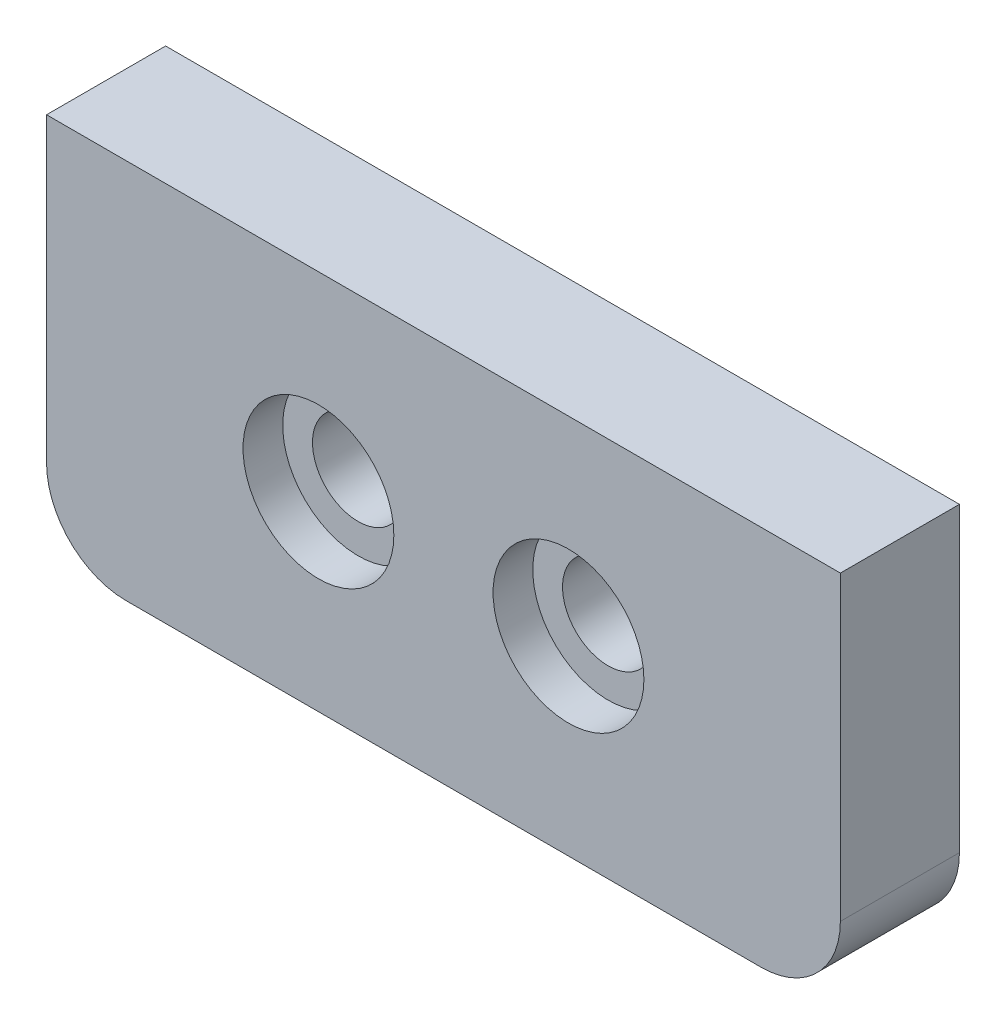
from build123d import *

# Parameters (mm, degrees)
SKETCH1_W           = 20
SKETCH1_H           = 9.6
SKETCH1_R           = 1.15
BOSS_EXTRUDE1_DEPTH = 3
FILLET1_R           = 2
SKETCH2_R           = 1.9
CUT_EXTRUDE1_DEPTH  = 1


with BuildPart() as part:
    # Sketch1 → Boss-Extrude1 (new body)
    with BuildSketch(Plane.XY):
        with Locations((10, 4.8)):
            Rectangle(SKETCH1_W, SKETCH1_H)
        with Locations((6.85, 4.8)):
            Circle(SKETCH1_R, mode=Mode.SUBTRACT)
        with Locations((13.15, 4.8)):
            Circle(SKETCH1_R, mode=Mode.SUBTRACT)
    extrude(amount=BOSS_EXTRUDE1_DEPTH)

    # Fillet1
    fillet1_edges = [part.edges().sort_by_distance(p)[0] for p in [
        (0, 0, 1.5),
        (20, 0, 1.5),
    ]]
    fillet(fillet1_edges, radius=FILLET1_R)

    # Sketch2 → Cut-Extrude1 (cut)
    with BuildSketch(Plane.XY.offset(3)):
        with Locations((6.85, 4.8)):
            Circle(SKETCH2_R)
        with Locations((13.15, 4.8)):
            Circle(SKETCH2_R)
    extrude(amount=-CUT_EXTRUDE1_DEPTH, mode=Mode.SUBTRACT)


solid = part.part
